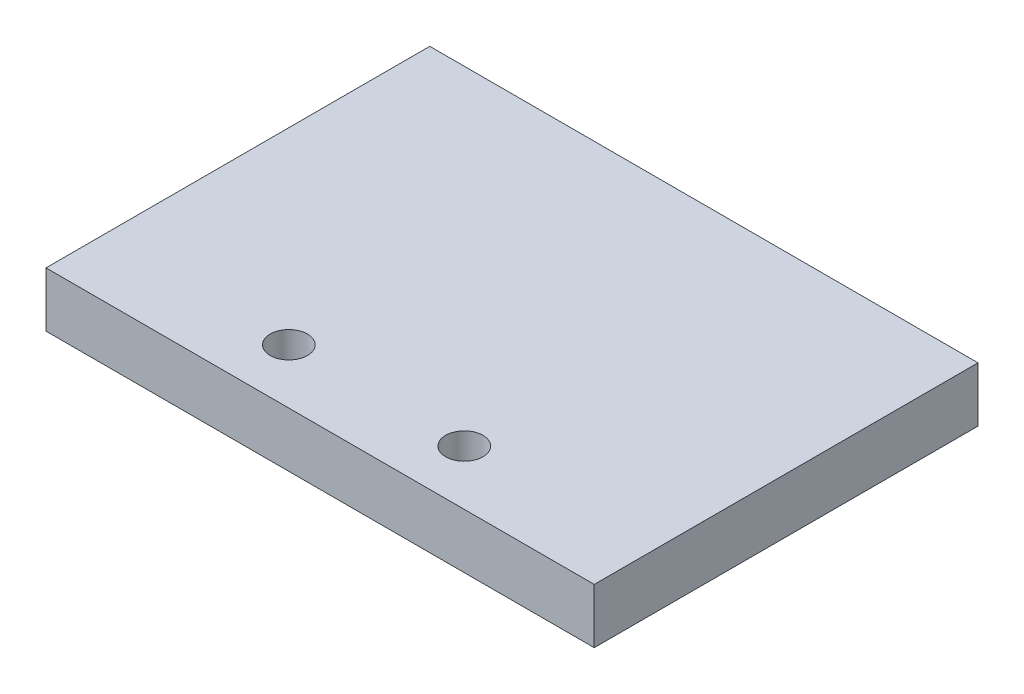
from build123d import *

# Parameters (mm, degrees)
SKETCH1_W            = 50
SKETCH1_H            = 35
BOSS_EXTRUDE1_DEPTH  = 5
M3_CLEARANCE_HOLE1_D = 3.4


with BuildPart() as part:
    # Sketch1 → Boss-Extrude1 (new body)
    with BuildSketch(Plane(origin=(0, 0, 0), x_dir=(1, 0, 0), z_dir=(0, 1, 0))):
        Rectangle(SKETCH1_W, SKETCH1_H)
    extrude(amount=BOSS_EXTRUDE1_DEPTH)

    # M3 Clearance Hole1 (through all)
    with Locations(Plane(origin=(0, 5, 0), x_dir=(1, 0, 0), z_dir=(0, 1, 0))):
        with Locations((-7.853135954, -12.5), (8.146864046, -12.5)):
            Hole(M3_CLEARANCE_HOLE1_D / 2)


solid = part.part
